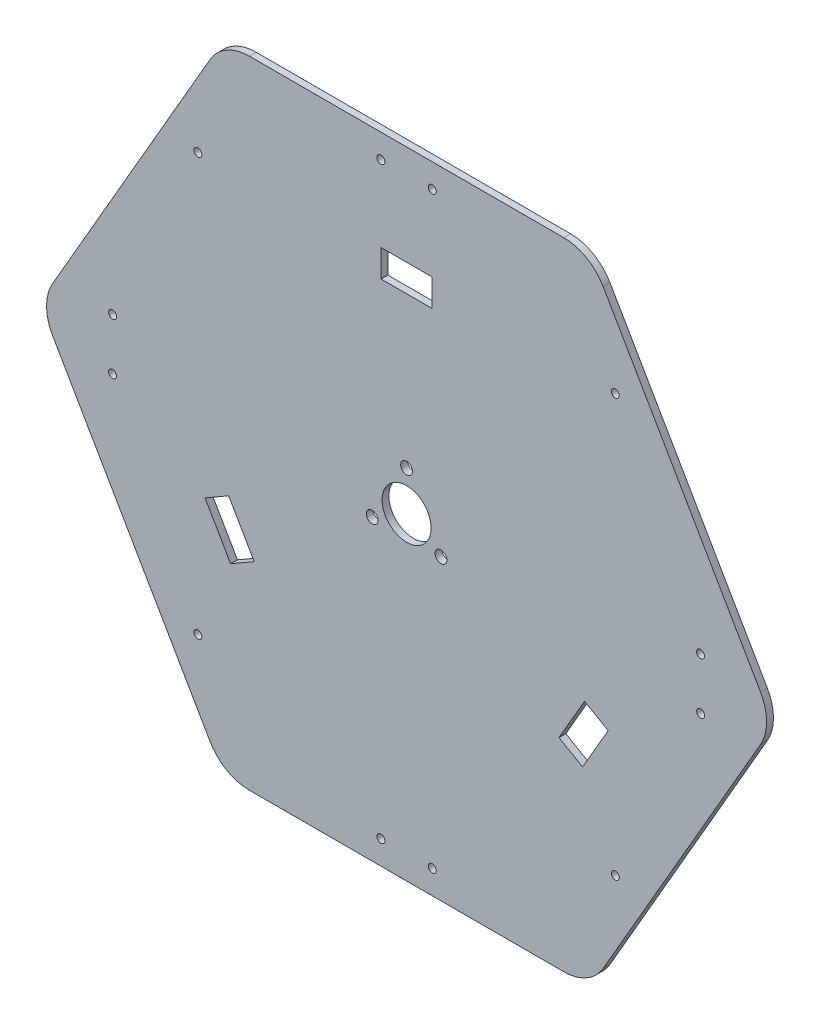
from build123d import *

# Parameters (mm, degrees)
CROQUIS1_W              = 22.5
CROQUIS1_H              = 12
CROQUIS1_R              = 2.6
CROQUIS1_R_2            = 10.8
SALIENTE_EXTRUIR1_DEPTH = 3
REDONDEO1_R             = 20
CROQUIS3_R              = 1.75
CORTAR_EXTRUIR1_DEPTH   = 212.545651301
MATRIZC1_COUNT          = 4


with BuildPart() as part:
    # Croquis1 → Saliente-Extruir1 (new body)
    with BuildSketch(Plane.XY):
        Polygon((-80.829037687, -140), (80.829037687, -140), (161.658075373, 0), (80.829037687, 140), (-80.829037687, 140), (-161.658075373, 0), align=None)
        with Locations((0, 90)):
            Rectangle(CROQUIS1_W, CROQUIS1_H, mode=Mode.SUBTRACT)
        Polygon((-67.121133918, -51.742785793), (-77.513438763, -57.742785793), (-88.763438763, -38.257214207), (-78.371133918, -32.257214207), align=None, mode=Mode.SUBTRACT)
        with Locations((-15.155444566, -8.75)):
            Circle(CROQUIS1_R, mode=Mode.SUBTRACT)
        Polygon((78.371133918, -32.257214207), (88.763438763, -38.257214207), (77.513438763, -57.742785793), (67.121133918, -51.742785793), align=None, mode=Mode.SUBTRACT)
        with Locations((15.155444566, -8.75)):
            Circle(CROQUIS1_R, mode=Mode.SUBTRACT)
        Circle(CROQUIS1_R_2, mode=Mode.SUBTRACT)
        with Locations((0, 17.5)):
            Circle(CROQUIS1_R, mode=Mode.SUBTRACT)
    extrude(amount=SALIENTE_EXTRUIR1_DEPTH)

    # Redondeo1
    redondeo1_edges = [part.edges().sort_by_distance(p)[0] for p in [
        (80.829037687, 140, 1.5),
        (-80.829037687, 140, 1.5),
        (-161.658075373, 0, 1.5),
        (-80.829037687, -140, 1.5),
        (80.829037687, -140, 1.5),
        (161.658075373, 0, 1.5),
    ]]
    fillet(redondeo1_edges, radius=REDONDEO1_R)

    # Croquis3 → Cortar-Extruir1 (cut, through all)
    with BuildSketch(Plane(origin=(0, 0, 0), x_dir=(1, 0, 0), z_dir=(0, 0, -1))):
        with Locations((129.505310752, 11.330246557)):
            Circle(CROQUIS3_R)
        with Locations((91.923881554, 91.923881554)):
            Circle(CROQUIS3_R)
        with Locations((11.330246557, 129.505310752)):
            Circle(CROQUIS3_R)
    cortar_extruir1 = extrude(amount=-CORTAR_EXTRUIR1_DEPTH, mode=Mode.SUBTRACT)

    # MatrizC1: Cortar-Extruir1 ×4 about axis
    matrizc1_axis = Axis((0, 0, 0), (0, 0, 1))
    for i in range(1, MATRIZC1_COUNT):
        add(cortar_extruir1.rotate(matrizc1_axis, i * 360 / MATRIZC1_COUNT), mode=Mode.SUBTRACT)


solid = part.part
